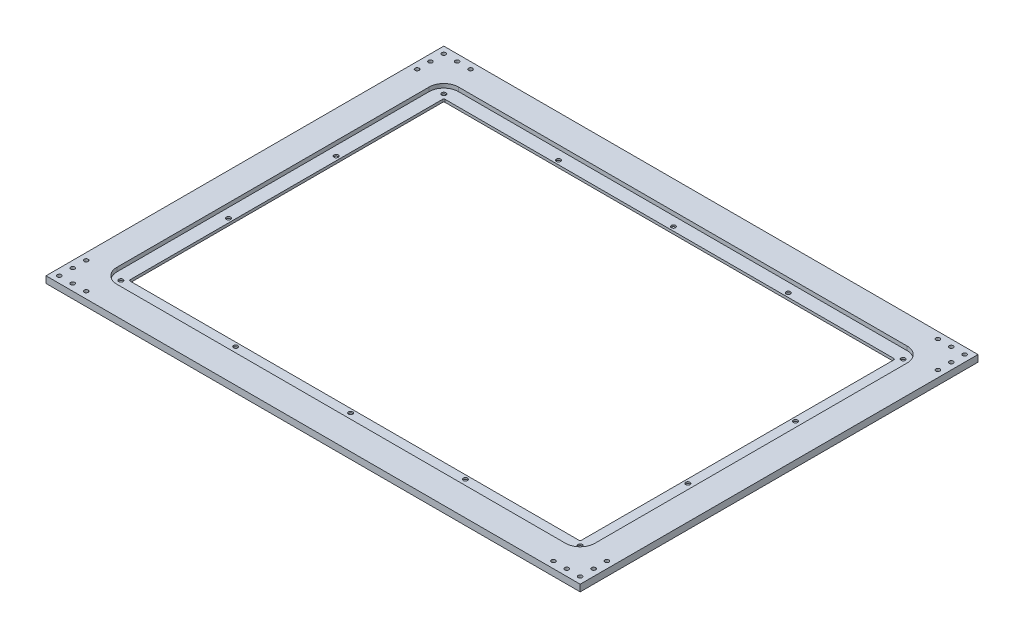
from build123d import *

# Parameters (mm, degrees)
SKETCH1_W           = 399.5
SKETCH1_H           = 297.5
BOSS_EXTRUDE1_DEPTH = 5
SKETCH2_R           = 1.6
CUT_EXTRUDE2_DEPTH  = 1.2
SKETCH3_R           = 1.5
CUT_EXTRUDE3_DEPTH  = 59.2
SKETCH4_R           = 1.5
CUT_EXTRUDE4_DEPTH  = 10.2
CUT_EXTRUDE5_DEPTH  = 3
CUT_EXTRUDE6_DEPTH  = 13
SKETCH9_R           = 1.6
CUT_EXTRUDE7_DEPTH  = 1.2


with BuildPart() as part:
    # Sketch1 → Boss-Extrude1 (new body)
    with BuildSketch(Plane(origin=(0, 0, 0), x_dir=(1, 0, 0), z_dir=(0, 1, 0))):
        with Locations((199.75, 148.75)):
            Rectangle(SKETCH1_W, SKETCH1_H)
    extrude(amount=BOSS_EXTRUDE1_DEPTH)

    # Sketch2 → Cut-Extrude2 (cut)
    with BuildSketch(Plane.XZ):
        with Locations((31, -5)):
            Circle(SKETCH2_R)
        with Locations((10, -5)):
            Circle(SKETCH2_R)
        with Locations((5, -10)):
            Circle(SKETCH2_R)
        with Locations((5, -31)):
            Circle(SKETCH2_R)
        with Locations((394.5, -31)):
            Circle(SKETCH2_R)
        with Locations((394.5, -10)):
            Circle(SKETCH2_R)
        with Locations((389.5, -5)):
            Circle(SKETCH2_R)
        with Locations((368.5, -5)):
            Circle(SKETCH2_R)
        with Locations((31, -292.5)):
            Circle(SKETCH2_R)
        with Locations((10, -292.5)):
            Circle(SKETCH2_R)
        with Locations((5, -287.5)):
            Circle(SKETCH2_R)
        with Locations((5, -266.5)):
            Circle(SKETCH2_R)
        with Locations((368.5, -292.5)):
            Circle(SKETCH2_R)
        with Locations((389.5, -292.5)):
            Circle(SKETCH2_R)
        with Locations((394.5, -287.5)):
            Circle(SKETCH2_R)
        with Locations((394.5, -266.5)):
            Circle(SKETCH2_R)
    extrude(amount=-CUT_EXTRUDE2_DEPTH, mode=Mode.SUBTRACT)

    # Sketch3 → Cut-Extrude3 (cut)
    with BuildSketch(Plane.XZ):
        with Locations((25, -5)):
            Circle(SKETCH3_R)
        with Locations((15, -5)):
            Circle(SKETCH3_R)
        with Locations((5, -15)):
            Circle(SKETCH3_R)
        with Locations((5, -25)):
            Circle(SKETCH3_R)
        with Locations((5, -272.5)):
            Circle(SKETCH3_R)
        with Locations((5, -282.5)):
            Circle(SKETCH3_R)
        with Locations((15, -292.5)):
            Circle(SKETCH3_R)
        with Locations((25, -292.5)):
            Circle(SKETCH3_R)
        with Locations((374.5, -5)):
            Circle(SKETCH3_R)
        with Locations((384.5, -5)):
            Circle(SKETCH3_R)
        with Locations((394.5, -15)):
            Circle(SKETCH3_R)
        with Locations((394.5, -25)):
            Circle(SKETCH3_R)
        with Locations((394.5, -272.5)):
            Circle(SKETCH3_R)
        with Locations((394.5, -282.5)):
            Circle(SKETCH3_R)
        with Locations((384.5, -292.5)):
            Circle(SKETCH3_R)
        with Locations((374.5, -292.5)):
            Circle(SKETCH3_R)
    extrude(amount=-CUT_EXTRUDE3_DEPTH, mode=Mode.SUBTRACT)

    # Sketch4 → Cut-Extrude4 (cut)
    with BuildSketch(Plane(origin=(0, 5, 0), x_dir=(1, 0, 0), z_dir=(0, 1, 0))):
        with Locations((5, 5)):
            Circle(SKETCH4_R)
        with Locations((394.5, 292.5)):
            Circle(SKETCH4_R)
        with Locations((394.5, 5)):
            Circle(SKETCH4_R)
        with Locations((5, 292.5)):
            Circle(SKETCH4_R)
    extrude(amount=-CUT_EXTRUDE4_DEPTH, mode=Mode.SUBTRACT)

    # Sketch5 → Cut-Extrude5 (cut)
    with BuildSketch(Plane(origin=(0, 5, 0), x_dir=(1, 0, 0), z_dir=(0, 1, 0))):
        with BuildLine():
            Line((32, 276.5), (367.5, 276.5))
            ThreePointArc((367.5, 276.5), (375.278174593, 273.278174593), (378.5, 265.5))
            Line((378.5, 265.5), (378.5, 32))
            ThreePointArc((378.5, 32), (375.278174593, 24.221825407), (367.5, 21))
            Line((367.5, 21), (32, 21))
            ThreePointArc((32, 21), (24.221825407, 24.221825407), (21, 32))
            Line((21, 32), (21, 265.5))
            ThreePointArc((21, 265.5), (24.221825407, 273.278174593), (32, 276.5))
        make_face()
    extrude(amount=-CUT_EXTRUDE5_DEPTH, mode=Mode.SUBTRACT)

    # Sketch6 → Cut-Extrude6 (cut)
    with BuildSketch(Plane(origin=(0, 2, 0), x_dir=(1, 0, 0), z_dir=(0, 1, 0))):
        with BuildLine():
            Line((368.5, 32), (368.5, 265.5))
            ThreePointArc((368.5, 265.5), (368.207106781, 266.207106781), (367.5, 266.5))
            Line((367.5, 266.5), (32, 266.5))
            ThreePointArc((32, 266.5), (31.292893219, 266.207106781), (31, 265.5))
            Line((31, 265.5), (31, 32))
            ThreePointArc((31, 32), (31.292893219, 31.292893219), (32, 31))
            Line((32, 31), (367.5, 31))
            ThreePointArc((367.5, 31), (368.207106781, 31.292893219), (368.5, 32))
        make_face()
    extrude(amount=-CUT_EXTRUDE6_DEPTH, mode=Mode.SUBTRACT)

    # Sketch9 → Cut-Extrude7 (cut)
    with BuildSketch(Plane(origin=(0, 2, 0), x_dir=(1, 0, 0), z_dir=(0, 1, 0))):
        with Locations((199.75, 28)):
            Circle(SKETCH9_R)
        with Locations((285.625, 28)):
            Circle(SKETCH9_R)
        with Locations((371.5, 28)):
            Circle(SKETCH9_R)
        with Locations((371.5, 108.5)):
            Circle(SKETCH9_R)
        with Locations((371.5, 189)):
            Circle(SKETCH9_R)
        with Locations((113.875, 28)):
            Circle(SKETCH9_R)
        with Locations((28, 28)):
            Circle(SKETCH9_R)
        with Locations((28, 108.5)):
            Circle(SKETCH9_R)
        with Locations((28, 189)):
            Circle(SKETCH9_R)
        with Locations((28, 269.5)):
            Circle(SKETCH9_R)
        with Locations((113.875, 269.5)):
            Circle(SKETCH9_R)
        with Locations((199.75, 269.5)):
            Circle(SKETCH9_R)
        with Locations((285.625, 269.5)):
            Circle(SKETCH9_R)
        with Locations((371.5, 269.5)):
            Circle(SKETCH9_R)
    extrude(amount=-CUT_EXTRUDE7_DEPTH, mode=Mode.SUBTRACT)


solid = part.part
